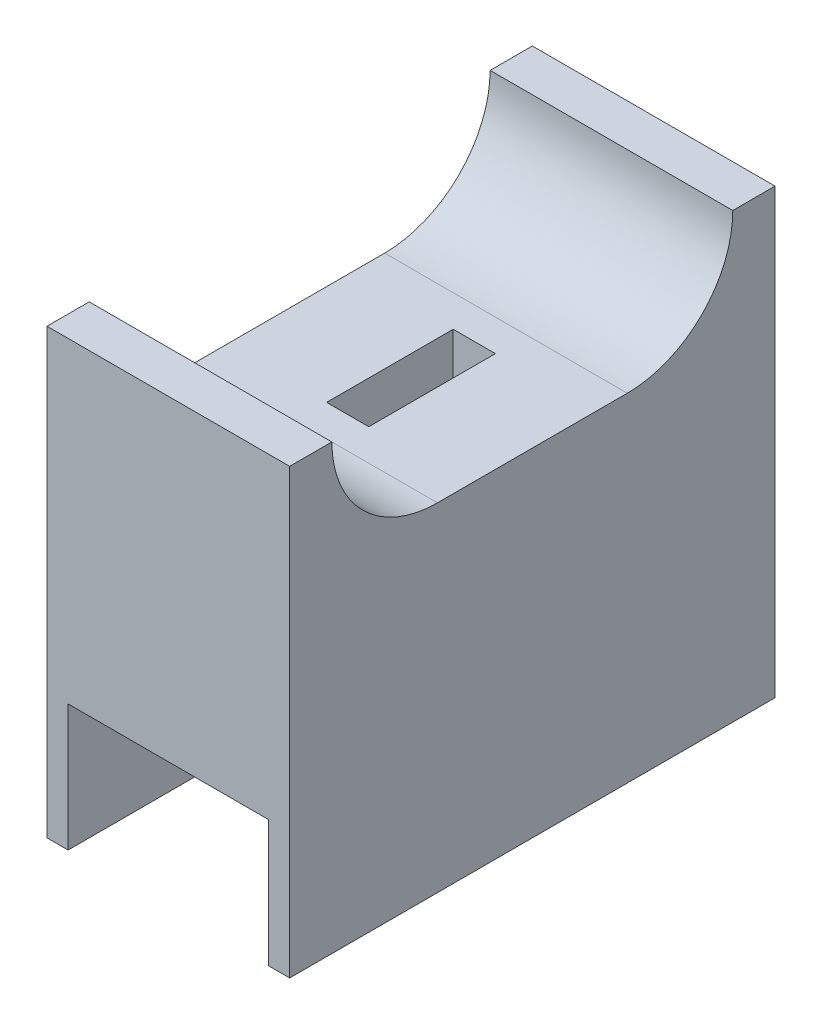
from build123d import *

# Parameters (mm, degrees)
SKETCH1_W           = 11.5
SKETCH1_H           = 23
BOSS_EXTRUDE1_DEPTH = 11
SKETCH3_W           = 11.5
SKETCH3_H           = 23
BOSS_EXTRUDE3_DEPTH = 6
SKETCH4_W           = 9.5
SKETCH4_H           = 6
CUT_EXTRUDE1_DEPTH  = 27.135464411
SKETCH7_W           = 2
SKETCH7_H           = 6
CUT_EXTRUDE2_DEPTH  = 10
SKETCH8_W           = 11.5
SKETCH8_H           = 23
BOSS_EXTRUDE4_DEPTH = 4
SKETCH9_W           = 19
SKETCH9_H           = 5
CUT_EXTRUDE3_DEPTH  = 23.12464689
FILLET1_R           = 5


with BuildPart() as part:
    # Sketch1 → Boss-Extrude1 (new body)
    with BuildSketch(Plane(origin=(0, 0, 0), x_dir=(1, 0, 0), z_dir=(0, 1, 0))):
        Rectangle(SKETCH1_W, SKETCH1_H)
    extrude(amount=BOSS_EXTRUDE1_DEPTH)

    # Sketch3 → Boss-Extrude3 (add)
    with BuildSketch(Plane.XZ):
        Rectangle(SKETCH3_W, SKETCH3_H)
    extrude(amount=BOSS_EXTRUDE3_DEPTH)

    # Sketch4 → Cut-Extrude1 (cut, through all)
    with BuildSketch(Plane.XY.offset(11.5)):
        with Locations((0, -3)):
            Rectangle(SKETCH4_W, SKETCH4_H)
    extrude(amount=-CUT_EXTRUDE1_DEPTH, mode=Mode.SUBTRACT)

    # Sketch7 → Cut-Extrude2 (cut)
    with BuildSketch(Plane.XZ):
        Rectangle(SKETCH7_W, SKETCH7_H)
    extrude(amount=-CUT_EXTRUDE2_DEPTH, mode=Mode.SUBTRACT)

    # Sketch8 → Boss-Extrude4 (add)
    with BuildSketch(Plane(origin=(0, 11, 0), x_dir=(1, 0, 0), z_dir=(0, 1, 0))):
        Rectangle(SKETCH8_W, SKETCH8_H)
    extrude(amount=BOSS_EXTRUDE4_DEPTH)

    # Sketch9 → Cut-Extrude3 (cut, through all)
    with BuildSketch(Plane.ZY.offset(5.75)):
        with Locations((0, 12.5)):
            Rectangle(SKETCH9_W, SKETCH9_H)
    extrude(amount=-CUT_EXTRUDE3_DEPTH, mode=Mode.SUBTRACT)

    # Fillet1
    fillet1_edges = [part.edges().sort_by_distance(p)[0] for p in [
        (0, 10, -9.5),
        (0, 10, 9.5),
    ]]
    fillet(fillet1_edges, radius=FILLET1_R - 0.0001)  # a hair under: the kernel refuses the full size


solid = part.part
